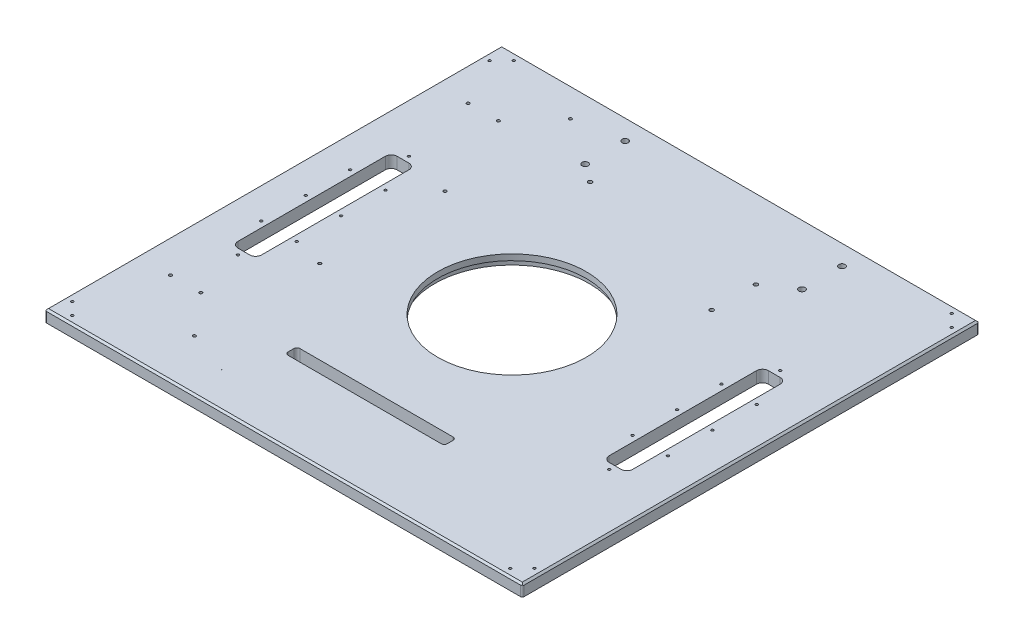
from build123d import *

# Parameters (mm, degrees)
SKETCH1_W                               = 810
SKETCH1_H                               = 775
MAINPLATE_DEPTH                         = 20
SKETCH3_R                               = 126
BUILDPLATEHOLE_DEPTH                    = 561.875431803
SKETCH11_R                              = 131
BUILDCYLINDERFIT_DEPTH                  = 10
SEALCHAMFER_SIZE                        = 3
SKETCH4_W                               = 40
SKETCH4_H                               = 270
CROSSFLOW1_DEPTH                        = 561.875431803
FILLET1_R                               = 10
OVERFLOW_DEPTH                          = 561.875431803
CROSSFLOW2_COUNT                        = 2
CROSSFLOW2_PITCH                        = 630
FILLET1_OF_CROSSFLOW2_R                 = 10
CIRPATTERN1_COUNT                       = 8
TAPPED_HOLE_FOR_M8X1_25_HELICOIL1_D     = 8.3
TAPPED_HOLE_FOR_M8X1_25_HELICOIL1_DEPTH = 14.656428431
TAPPED_HOLE_FOR_M8X1_25_HELICOIL1_TIP   = 2.493571569
M8_TAPPED_HOLE2_D                       = 6.8
M8_TAPPED_HOLE2_DEPTH                   = 18
M8_TAPPED_HOLE2_TIP                     = 2.042926105
M6_TAPPED_HOLE2_D                       = 5
M6_TAPPED_HOLE2_DEPTH                   = 15
M6_TAPPED_HOLE2_TIP                     = 1.502151548
M6_TAPPED_HOLE3_D                       = 5
M6_TAPPED_HOLE3_DEPTH                   = 13.497848452
M6_TAPPED_HOLE3_TIP                     = 1.502151548
TAPPED_HOLE_FOR_M10X1_5_HELICOIL1_D     = 10.5
TAPPED_HOLE_FOR_M10X1_5_HELICOIL1_DEPTH = 18
TAPPED_HOLE_FOR_M10X1_5_HELICOIL1_TIP   = 3.15451825
M8_TAPPED_HOLE4_D                       = 6.8
M8_TAPPED_HOLE4_DEPTH                   = 18
M8_TAPPED_HOLE4_TIP                     = 2.042926105
M5_TAPPED_HOLE1_AT_2_COUNT              = 2
M5_TAPPED_HOLE1_AT_2_PITCH              = 28.991378029
FILLET2_R                               = 3


# Read off the part's stored shape, not the designer's step: CrvPattern2, CrvPattern3, CrvPattern4, CrvPattern5, CrvPattern6
with BuildPart() as part:
    # Sketch1 → MainPlate (new body)
    with BuildSketch(Plane(origin=(0, 0, 0), x_dir=(1, 0, 0), z_dir=(0, 1, 0))):
        Rectangle(SKETCH1_W, SKETCH1_H)
    extrude(amount=MAINPLATE_DEPTH)

    # Sketch3 → BuildPlateHole (cut, through all)
    with BuildSketch(Plane(origin=(0, 20, 0), x_dir=(1, 0, 0), z_dir=(0, 1, 0))):
        with Locations(Location((0, 0, 0), (0, 0, 270))):
            Circle(SKETCH3_R)
    extrude(amount=-BUILDPLATEHOLE_DEPTH, mode=Mode.SUBTRACT)

    # Sketch11 → BuildCylinderFit (cut)
    with BuildSketch(Plane(origin=(0, 0, 0), x_dir=(-1, 0, 0), z_dir=(0, -1, 0))):
        with Locations(Location((0, 0, 0), (0, 0, 90))):
            Circle(SKETCH11_R)
    extrude(amount=-BUILDCYLINDERFIT_DEPTH, mode=Mode.SUBTRACT)

    # SealChamfer
    sealchamfer_edges = [part.edges().sort_by_distance(p)[0] for p in [
        (-405, 20, 0),
        (0, 20, 387.5),
        (405, 20, 0),
        (0, 20, -387.5),
    ]]
    chamfer(sealchamfer_edges, length=SEALCHAMFER_SIZE)

    # Sketch4 → CrossFlow1 (cut, through all)
    with BuildSketch(Plane.XZ):
        with Locations((310, 0)):
            Rectangle(SKETCH4_W, SKETCH4_H)
    crossflow1 = extrude(amount=-CROSSFLOW1_DEPTH, mode=Mode.SUBTRACT)

    # Fillet1
    fillet1_edges = [part.edges().sort_by_distance(p)[0] for p in [
        (330, 10, 135),
        (330, 10, -135),
        (290, 10, -135),
        (290, 10, 135),
    ]]
    fillet(fillet1_edges, radius=FILLET1_R)

    # Sketch10 → Overflow (cut, through all)
    with BuildSketch(Plane(origin=(0, 20, 0), x_dir=(1, 0, 0), z_dir=(0, 1, 0))):
        with BuildLine():
            Line((-130, -230), (130, -230))
            ThreePointArc((130, -230), (133.535533906, -231.464466094), (135, -235))
            Line((135, -235), (135, -245))
            ThreePointArc((135, -245), (133.535533906, -248.535533906), (130, -250))
            Line((130, -250), (-130, -250))
            ThreePointArc((-130, -250), (-133.535533906, -248.535533906), (-135, -245))
            Line((-135, -245), (-135, -235))
            ThreePointArc((-135, -235), (-133.535533906, -231.464466094), (-130, -230))
        make_face()
    extrude(amount=-OVERFLOW_DEPTH, mode=Mode.SUBTRACT)

    # CrossFlow2: CrossFlow1 ×2
    with Locations(*[(-i * CROSSFLOW2_PITCH, 0, 0) for i in range(1, CROSSFLOW2_COUNT)]):
        add(crossflow1, mode=Mode.SUBTRACT)

    # Fillet1 of CrossFlow2
    fillet1_of_crossflow2_edges = [part.edges().sort_by_distance(p)[0] for p in [
        (-300, 10, 135),
        (-300, 10, -135),
        (-340, 10, -135),
        (-340, 10, 135),
    ]]
    fillet(fillet1_of_crossflow2_edges, radius=FILLET1_OF_CROSSFLOW2_R)

    # Sketch17 → Tapped Hole for M6x1.0 Helicoil1 (revolve, cut)
    with BuildSketch(Plane(origin=(0, 0, 204.5), x_dir=(0, 0, -1), z_dir=(1, 0, 0))):
        Polygon((0, 0), (0, 18.127689434), (3.125, 16.25), (3.125, 0), align=None)
    tapped_hole_for_m6x1_0_helicoil1 = revolve(axis=Axis((0, -6.35, 204.5), (0, 1, 0)), mode=Mode.SUBTRACT)

    # CirPattern1: Tapped Hole for M6x1.0 Helicoil1 ×8 about axis
    cirpattern1_axis = Axis((0, 0, 0), (0, 1, 0))
    for i in range(1, CIRPATTERN1_COUNT):
        add(tapped_hole_for_m6x1_0_helicoil1.rotate(cirpattern1_axis, i * 360 / CIRPATTERN1_COUNT), mode=Mode.SUBTRACT)

    # Tapped Hole for M8x1.25 Helicoil1
    with Locations(Plane(origin=(0, 0, 0), x_dir=(-1, 0, 0), z_dir=(0, -1, 0))):
        with Locations((74.25, -128.604772462), (-74.25, -128.604772462), (-148.5, 0), (-74.25, 128.604772462), (74.25, 128.604772462), (148.5, 0)):
            Hole(TAPPED_HOLE_FOR_M8X1_25_HELICOIL1_D / 2, depth=TAPPED_HOLE_FOR_M8X1_25_HELICOIL1_DEPTH)
            with Locations((0, 0, -(TAPPED_HOLE_FOR_M8X1_25_HELICOIL1_DEPTH + TAPPED_HOLE_FOR_M8X1_25_HELICOIL1_TIP / 2))):  # 118° drill point
                Cone(0, TAPPED_HOLE_FOR_M8X1_25_HELICOIL1_D / 2, TAPPED_HOLE_FOR_M8X1_25_HELICOIL1_TIP, mode=Mode.SUBTRACT)

    # M8 Tapped Hole2
    with Locations(Plane(origin=(0, 0, 0), x_dir=(-1, 0, 0), z_dir=(0, -1, 0))):
        with Locations((345, -172.5), (345, 172.5), (165, -327.5), (-165, -327.5), (-165, 327.5), (165, 327.5), (-345, -202.5), (-345, 202.5)):
            Hole(M8_TAPPED_HOLE2_D / 2, depth=M8_TAPPED_HOLE2_DEPTH)
            with Locations((0, 0, -(M8_TAPPED_HOLE2_DEPTH + M8_TAPPED_HOLE2_TIP / 2))):  # 118° drill point
                Cone(0, M8_TAPPED_HOLE2_D / 2, M8_TAPPED_HOLE2_TIP, mode=Mode.SUBTRACT)

    # Sketch27 → M5 Tapped Hole6 (revolve, cut)
    with BuildSketch(Plane(origin=(-283, 0, 0), x_dir=(0, 0, -1), z_dir=(1, 0, 0))):
        Polygon((0, 0), (0, 13.6618073), (2.1, 12.4), (2.1, 0), align=None)
    revolve(axis=Axis((-283, -6.35, 0), (0, 1, 0)), mode=Mode.SUBTRACT)

    # CrvPattern2 outline → CrvPattern2 (revolve, cut)
    with BuildSketch(Plane(origin=(-283, 0, 75.353918671), x_dir=(1, 0, 0), z_dir=(0, 0, 1))):
        Polygon((2.1, 12.4), (0, 13.6618073), (0, 0), (2.1, 0), align=None)
    revolve(axis=Axis((-283, 0, 75.353918671), (0, 1, 0)), mode=Mode.SUBTRACT)

    # CrvPattern2 2 outline → CrvPattern2 2 (revolve, cut)
    with BuildSketch(Plane(origin=(-320, 0, 152), x_dir=(1, 0, 0), z_dir=(0, 0, 1))):
        Polygon((2.1, 12.4), (0, 13.6618073), (0, 0), (2.1, 0), align=None)
    revolve(axis=Axis((-320, 0, 152), (0, 1, 0)), mode=Mode.SUBTRACT)

    # CrvPattern2 3 outline → CrvPattern2 3 (revolve, cut)
    with BuildSketch(Plane(origin=(-357, 0, 75.353918671), x_dir=(1, 0, 0), z_dir=(0, 0, 1))):
        Polygon((2.1, 12.4), (0, 13.6618073), (0, 0), (2.1, 0), align=None)
    revolve(axis=Axis((-357, 0, 75.353918671), (0, 1, 0)), mode=Mode.SUBTRACT)

    # CrvPattern2 4 outline → CrvPattern2 4 (revolve, cut)
    with BuildSketch(Plane(origin=(-357, 0, 0), x_dir=(1, 0, 0), z_dir=(0, 0, 1))):
        Polygon((2.1, 12.4), (0, 13.6618073), (0, 0), (2.1, 0), align=None)
    revolve(axis=Axis((-357, 0, 0), (0, 1, 0)), mode=Mode.SUBTRACT)

    # CrvPattern2 5 outline → CrvPattern2 5 (revolve, cut)
    with BuildSketch(Plane(origin=(-357, 0, -75.353918671), x_dir=(1, 0, 0), z_dir=(0, 0, 1))):
        Polygon((2.1, 12.4), (0, 13.6618073), (0, 0), (2.1, 0), align=None)
    revolve(axis=Axis((-357, 0, -75.353918671), (0, 1, 0)), mode=Mode.SUBTRACT)

    # CrvPattern2 6 outline → CrvPattern2 6 (revolve, cut)
    with BuildSketch(Plane(origin=(-320, 0, -152), x_dir=(1, 0, 0), z_dir=(0, 0, 1))):
        Polygon((2.1, 12.4), (0, 13.6618073), (0, 0), (2.1, 0), align=None)
    revolve(axis=Axis((-320, 0, -152), (0, 1, 0)), mode=Mode.SUBTRACT)

    # CrvPattern2 7 outline → CrvPattern2 7 (revolve, cut)
    with BuildSketch(Plane(origin=(-283, 0, -75.353918671), x_dir=(1, 0, 0), z_dir=(0, 0, 1))):
        Polygon((2.1, 12.4), (0, 13.6618073), (0, 0), (2.1, 0), align=None)
    revolve(axis=Axis((-283, 0, -75.353918671), (0, 1, 0)), mode=Mode.SUBTRACT)

    # Sketch31 → M5 Tapped Hole5 (revolve, cut)
    with BuildSketch(Plane(origin=(273, 0, 0), x_dir=(0, 0, -1), z_dir=(1, 0, 0))):
        Polygon((0, 0), (0, 13.6618073), (2.1, 12.4), (2.1, 0), align=None)
    revolve(axis=Axis((273, -6.35, 0), (0, 1, 0)), mode=Mode.SUBTRACT)

    # CrvPattern3 outline → CrvPattern3 (revolve, cut)
    with BuildSketch(Plane(origin=(273, 0, -75.353918671), x_dir=(1, 0, 0), z_dir=(0, 0, 1))):
        Polygon((2.1, 12.4), (0, 13.6618073), (0, 0), (2.1, 0), align=None)
    revolve(axis=Axis((273, 0, -75.353918671), (0, 1, 0)), mode=Mode.SUBTRACT)

    # CrvPattern3 2 outline → CrvPattern3 2 (revolve, cut)
    with BuildSketch(Plane(origin=(310, 0, -152), x_dir=(1, 0, 0), z_dir=(0, 0, 1))):
        Polygon((2.1, 12.4), (0, 13.6618073), (0, 0), (2.1, 0), align=None)
    revolve(axis=Axis((310, 0, -152), (0, 1, 0)), mode=Mode.SUBTRACT)

    # CrvPattern3 3 outline → CrvPattern3 3 (revolve, cut)
    with BuildSketch(Plane(origin=(347, 0, -75.353918671), x_dir=(1, 0, 0), z_dir=(0, 0, 1))):
        Polygon((2.1, 12.4), (0, 13.6618073), (0, 0), (2.1, 0), align=None)
    revolve(axis=Axis((347, 0, -75.353918671), (0, 1, 0)), mode=Mode.SUBTRACT)

    # CrvPattern3 4 outline → CrvPattern3 4 (revolve, cut)
    with BuildSketch(Plane(origin=(347, 0, 0), x_dir=(1, 0, 0), z_dir=(0, 0, 1))):
        Polygon((2.1, 12.4), (0, 13.6618073), (0, 0), (2.1, 0), align=None)
    revolve(axis=Axis((347, 0, 0), (0, 1, 0)), mode=Mode.SUBTRACT)

    # CrvPattern3 5 outline → CrvPattern3 5 (revolve, cut)
    with BuildSketch(Plane(origin=(347, 0, 75.353918671), x_dir=(1, 0, 0), z_dir=(0, 0, 1))):
        Polygon((2.1, 12.4), (0, 13.6618073), (0, 0), (2.1, 0), align=None)
    revolve(axis=Axis((347, 0, 75.353918671), (0, 1, 0)), mode=Mode.SUBTRACT)

    # CrvPattern3 6 outline → CrvPattern3 6 (revolve, cut)
    with BuildSketch(Plane(origin=(310, 0, 152), x_dir=(1, 0, 0), z_dir=(0, 0, 1))):
        Polygon((2.1, 12.4), (0, 13.6618073), (0, 0), (2.1, 0), align=None)
    revolve(axis=Axis((310, 0, 152), (0, 1, 0)), mode=Mode.SUBTRACT)

    # CrvPattern3 7 outline → CrvPattern3 7 (revolve, cut)
    with BuildSketch(Plane(origin=(273, 0, 75.353918671), x_dir=(1, 0, 0), z_dir=(0, 0, 1))):
        Polygon((2.1, 12.4), (0, 13.6618073), (0, 0), (2.1, 0), align=None)
    revolve(axis=Axis((273, 0, 75.353918671), (0, 1, 0)), mode=Mode.SUBTRACT)

    # Sketch33 → M5 Tapped Hole4 (revolve, cut)
    with BuildSketch(Plane(origin=(280, 20, 0), x_dir=(0, 0, 1), z_dir=(1, 0, 0))):
        Polygon((0, 0), (0, 13.6618073), (2.1, 12.4), (2.1, 0), align=None)
    revolve(axis=Axis((280, 26.35, 0), (0, -1, 0)), mode=Mode.SUBTRACT)

    # CrvPattern4 outline → CrvPattern4 (revolve, cut)
    with BuildSketch(Plane(origin=(280, 0, -75.353918671), x_dir=(1, 0, 0), z_dir=(0, 0, 1))):
        Polygon((0, 20), (0, 6.3381927), (2.1, 7.6), (2.1, 20), align=None)
    revolve(axis=Axis((280, 0, -75.353918671), (0, 1, 0)), mode=Mode.SUBTRACT)

    # CrvPattern4 2 outline → CrvPattern4 2 (revolve, cut)
    with BuildSketch(Plane(origin=(310, 0, -145), x_dir=(1, 0, 0), z_dir=(0, 0, 1))):
        Polygon((0, 20), (0, 6.3381927), (2.1, 7.6), (2.1, 20), align=None)
    revolve(axis=Axis((310, 0, -145), (0, 1, 0)), mode=Mode.SUBTRACT)

    # CrvPattern4 3 outline → CrvPattern4 3 (revolve, cut)
    with BuildSketch(Plane(origin=(340, 0, -75.353918671), x_dir=(1, 0, 0), z_dir=(0, 0, 1))):
        Polygon((0, 20), (0, 6.3381927), (2.1, 7.6), (2.1, 20), align=None)
    revolve(axis=Axis((340, 0, -75.353918671), (0, 1, 0)), mode=Mode.SUBTRACT)

    # CrvPattern4 4 outline → CrvPattern4 4 (revolve, cut)
    with BuildSketch(Plane(origin=(340, 0, 0), x_dir=(1, 0, 0), z_dir=(0, 0, 1))):
        Polygon((0, 20), (0, 6.3381927), (2.1, 7.6), (2.1, 20), align=None)
    revolve(axis=Axis((340, 0, 0), (0, 1, 0)), mode=Mode.SUBTRACT)

    # CrvPattern4 5 outline → CrvPattern4 5 (revolve, cut)
    with BuildSketch(Plane(origin=(340, 0, 75.353918671), x_dir=(1, 0, 0), z_dir=(0, 0, 1))):
        Polygon((0, 20), (0, 6.3381927), (2.1, 7.6), (2.1, 20), align=None)
    revolve(axis=Axis((340, 0, 75.353918671), (0, 1, 0)), mode=Mode.SUBTRACT)

    # CrvPattern4 6 outline → CrvPattern4 6 (revolve, cut)
    with BuildSketch(Plane(origin=(310, 0, 145), x_dir=(1, 0, 0), z_dir=(0, 0, 1))):
        Polygon((0, 20), (0, 6.3381927), (2.1, 7.6), (2.1, 20), align=None)
    revolve(axis=Axis((310, 0, 145), (0, 1, 0)), mode=Mode.SUBTRACT)

    # CrvPattern4 7 outline → CrvPattern4 7 (revolve, cut)
    with BuildSketch(Plane(origin=(280, 0, 75.353918671), x_dir=(1, 0, 0), z_dir=(0, 0, 1))):
        Polygon((0, 20), (0, 6.3381927), (2.1, 7.6), (2.1, 20), align=None)
    revolve(axis=Axis((280, 0, 75.353918671), (0, 1, 0)), mode=Mode.SUBTRACT)

    # Sketch35 → M5 Tapped Hole3 (revolve, cut)
    with BuildSketch(Plane(origin=(-350, 20, 0), x_dir=(0, 0, 1), z_dir=(1, 0, 0))):
        Polygon((0, 0), (0, 13.6618073), (2.1, 12.4), (2.1, 0), align=None)
    revolve(axis=Axis((-350, 26.35, 0), (0, -1, 0)), mode=Mode.SUBTRACT)

    # CrvPattern5 outline → CrvPattern5 (revolve, cut)
    with BuildSketch(Plane(origin=(-350, 0, -75.353918671), x_dir=(1, 0, 0), z_dir=(0, 0, 1))):
        Polygon((0, 20), (0, 6.3381927), (2.1, 7.6), (2.1, 20), align=None)
    revolve(axis=Axis((-350, 0, -75.353918671), (0, 1, 0)), mode=Mode.SUBTRACT)

    # CrvPattern5 2 outline → CrvPattern5 2 (revolve, cut)
    with BuildSketch(Plane(origin=(-320, 0, -145), x_dir=(1, 0, 0), z_dir=(0, 0, 1))):
        Polygon((0, 20), (0, 6.3381927), (2.1, 7.6), (2.1, 20), align=None)
    revolve(axis=Axis((-320, 0, -145), (0, 1, 0)), mode=Mode.SUBTRACT)

    # CrvPattern5 3 outline → CrvPattern5 3 (revolve, cut)
    with BuildSketch(Plane(origin=(-290, 0, -75.353918671), x_dir=(1, 0, 0), z_dir=(0, 0, 1))):
        Polygon((0, 20), (0, 6.3381927), (2.1, 7.6), (2.1, 20), align=None)
    revolve(axis=Axis((-290, 0, -75.353918671), (0, 1, 0)), mode=Mode.SUBTRACT)

    # CrvPattern5 4 outline → CrvPattern5 4 (revolve, cut)
    with BuildSketch(Plane(origin=(-290, 0, 0), x_dir=(1, 0, 0), z_dir=(0, 0, 1))):
        Polygon((0, 20), (0, 6.3381927), (2.1, 7.6), (2.1, 20), align=None)
    revolve(axis=Axis((-290, 0, 0), (0, 1, 0)), mode=Mode.SUBTRACT)

    # CrvPattern5 5 outline → CrvPattern5 5 (revolve, cut)
    with BuildSketch(Plane(origin=(-290, 0, 75.353918671), x_dir=(1, 0, 0), z_dir=(0, 0, 1))):
        Polygon((0, 20), (0, 6.3381927), (2.1, 7.6), (2.1, 20), align=None)
    revolve(axis=Axis((-290, 0, 75.353918671), (0, 1, 0)), mode=Mode.SUBTRACT)

    # CrvPattern5 6 outline → CrvPattern5 6 (revolve, cut)
    with BuildSketch(Plane(origin=(-320, 0, 145), x_dir=(1, 0, 0), z_dir=(0, 0, 1))):
        Polygon((0, 20), (0, 6.3381927), (2.1, 7.6), (2.1, 20), align=None)
    revolve(axis=Axis((-320, 0, 145), (0, 1, 0)), mode=Mode.SUBTRACT)

    # CrvPattern5 7 outline → CrvPattern5 7 (revolve, cut)
    with BuildSketch(Plane(origin=(-350, 0, 75.353918671), x_dir=(1, 0, 0), z_dir=(0, 0, 1))):
        Polygon((0, 20), (0, 6.3381927), (2.1, 7.6), (2.1, 20), align=None)
    revolve(axis=Axis((-350, 0, 75.353918671), (0, 1, 0)), mode=Mode.SUBTRACT)

    # M6 Tapped Hole2
    with Locations(Plane(origin=(0, 20, 0), x_dir=(1, 0, 0), z_dir=(0, 1, 0))):
        with Locations((-296.207106781, 273.080412807), (-347.5, 273.080412807), (-296.207106781, -231.919587193), (-347.5, -231.919587193)):
            Hole(M6_TAPPED_HOLE2_D / 2, depth=M6_TAPPED_HOLE2_DEPTH)
            with Locations((0, 0, -(M6_TAPPED_HOLE2_DEPTH + M6_TAPPED_HOLE2_TIP / 2))):  # 118° drill point
                Cone(0, M6_TAPPED_HOLE2_D / 2, M6_TAPPED_HOLE2_TIP, mode=Mode.SUBTRACT)

    # M6 Tapped Hole3
    with Locations(Plane(origin=(0, 20, 0), x_dir=(1, 0, 0), z_dir=(0, 1, 0))):
        with Locations((-238, -300.919587193), (-238, -88.252920526), (-238, 124.41374614), (-238, 337.080412807)):
            Hole(M6_TAPPED_HOLE3_D / 2, depth=M6_TAPPED_HOLE3_DEPTH)
            with Locations((0, 0, -(M6_TAPPED_HOLE3_DEPTH + M6_TAPPED_HOLE3_TIP / 2))):  # 118° drill point
                Cone(0, M6_TAPPED_HOLE3_D / 2, M6_TAPPED_HOLE3_TIP, mode=Mode.SUBTRACT)

    # Tapped Hole for M10x1.5 Helicoil1
    with Locations(Plane(origin=(0, 20, 0), x_dir=(1, 0, 0), z_dir=(0, 1, 0))):
        with Locations((209.0925, 283.000832071), (209.0925, 350.895382341), (-158.9075, 283.000832071), (-158.9075, 350.895382341)):
            Hole(TAPPED_HOLE_FOR_M10X1_5_HELICOIL1_D / 2, depth=TAPPED_HOLE_FOR_M10X1_5_HELICOIL1_DEPTH)
            with Locations((0, 0, -(TAPPED_HOLE_FOR_M10X1_5_HELICOIL1_DEPTH + TAPPED_HOLE_FOR_M10X1_5_HELICOIL1_TIP / 2))):  # 118° drill point
                Cone(0, TAPPED_HOLE_FOR_M10X1_5_HELICOIL1_D / 2, TAPPED_HOLE_FOR_M10X1_5_HELICOIL1_TIP, mode=Mode.SUBTRACT)

    # M8 Tapped Hole4
    with Locations(Plane(origin=(0, 20, 0), x_dir=(1, 0, 0), z_dir=(0, 1, 0))):
        with Locations((162.9, 251.000832071), (162.9, 176.000832071), (-128.5, 261.000832071)):
            Hole(M8_TAPPED_HOLE4_D / 2, depth=M8_TAPPED_HOLE4_DEPTH)
            with Locations((0, 0, -(M8_TAPPED_HOLE4_DEPTH + M8_TAPPED_HOLE4_TIP / 2))):  # 118° drill point
                Cone(0, M8_TAPPED_HOLE4_D / 2, M8_TAPPED_HOLE4_TIP, mode=Mode.SUBTRACT)

    # Sketch45 → M5 Tapped Hole1 (revolve, cut)
    with BuildSketch(Plane(origin=(371.5, 20, 374.5), x_dir=(0, 0, 1), z_dir=(1, 0, 0))):
        Polygon((0, 0), (0, 13.6618073), (2.1, 12.4), (2.1, 0), align=None)
    m5_tapped_hole1 = revolve(axis=Axis((371.5, 26.35, 374.5), (0, -1, 0)), mode=Mode.SUBTRACT)

    # M5 Tapped Hole1 at 2: M5 Tapped Hole1 ×2
    with Locations(*[Vector(0.7071067811865476, 0, -0.7071067811865476) * (i * M5_TAPPED_HOLE1_AT_2_PITCH) for i in range(1, M5_TAPPED_HOLE1_AT_2_COUNT)]):
        add(m5_tapped_hole1, mode=Mode.SUBTRACT)

    # Mirror3: M5 Tapped Hole1 across plane
    add(m5_tapped_hole1.mirror(Plane(origin=(0, 0, 0), x_dir=(0, 0, 1), z_dir=(1, 0, 0))), mode=Mode.SUBTRACT)

    # Mirror3 copy 1 sketch → Mirror3 copy 1 (revolve, cut)
    with BuildSketch(Plane(origin=(-392, 20, 354), x_dir=(0, 0, 1), z_dir=(-1, 0, 0))):
        Polygon((0, 0), (0, -13.6618073), (2.1, -12.4), (2.1, 0), align=None)
    revolve(axis=Axis((-392, 26.35, 354), (0, 1, 0)), mode=Mode.SUBTRACT)

    # Mirror4: M5 Tapped Hole1 across plane
    add(m5_tapped_hole1.mirror(Plane.XY), mode=Mode.SUBTRACT)

    # Mirror4 copy 1 sketch → Mirror4 copy 1 (revolve, cut)
    with BuildSketch(Plane(origin=(392, 20, -354), x_dir=(0, 0, -1), z_dir=(1, 0, 0))):
        Polygon((0, 0), (0, -13.6618073), (2.1, -12.4), (2.1, 0), align=None)
    revolve(axis=Axis((392, 26.35, -354), (0, 1, 0)), mode=Mode.SUBTRACT)

    # Mirror4 copy 2 sketch → Mirror4 copy 2 (revolve, cut)
    with BuildSketch(Plane(origin=(-371.5, 20, -374.5), x_dir=(0, 0, -1), z_dir=(-1, 0, 0))):
        Polygon((0, 0), (0, 13.6618073), (2.1, 12.4), (2.1, 0), align=None)
    revolve(axis=Axis((-371.5, 26.35, -374.5), (0, -1, 0)), mode=Mode.SUBTRACT)

    # Mirror4 copy 3 sketch → Mirror4 copy 3 (revolve, cut)
    with BuildSketch(Plane(origin=(-392, 20, -354), x_dir=(0, 0, -1), z_dir=(-1, 0, 0))):
        Polygon((0, 0), (0, 13.6618073), (2.1, 12.4), (2.1, 0), align=None)
    revolve(axis=Axis((-392, 26.35, -354), (0, -1, 0)), mode=Mode.SUBTRACT)

    # Sketch47 → M5 Tapped Hole2 (revolve, cut)
    with BuildSketch(Plane(origin=(0, 0, 223), x_dir=(0, 0, -1), z_dir=(1, 0, 0))):
        Polygon((0, 0), (0, 13.6618073), (2.1, 12.4), (2.1, 0), align=None)
    revolve(axis=Axis((0, -6.35, 223), (0, 1, 0)), mode=Mode.SUBTRACT)

    # CrvPattern6 outline → CrvPattern6 (revolve, cut)
    with BuildSketch(Plane(origin=(-71.428355745, 0, 223), x_dir=(1, 0, 0), z_dir=(0, 0, 1))):
        Polygon((2.1, 12.4), (0, 13.6618073), (0, 0), (2.1, 0), align=None)
    revolve(axis=Axis((-71.428355745, 0, 223), (0, 1, 0)), mode=Mode.SUBTRACT)

    # CrvPattern6 2 outline → CrvPattern6 2 (revolve, cut)
    with BuildSketch(Plane(origin=(-142, 0, 240.000000006), x_dir=(1, 0, 0), z_dir=(0, 0, 1))):
        Polygon((2.1, 12.4), (0, 13.6618073), (0, 0), (2.1, 0), align=None)
    revolve(axis=Axis((-142, 0, 240.000000006), (0, 1, 0)), mode=Mode.SUBTRACT)

    # CrvPattern6 3 outline → CrvPattern6 3 (revolve, cut)
    with BuildSketch(Plane(origin=(-71.428355734, 0, 257), x_dir=(1, 0, 0), z_dir=(0, 0, 1))):
        Polygon((2.1, 12.4), (0, 13.6618073), (0, 0), (2.1, 0), align=None)
    revolve(axis=Axis((-71.428355734, 0, 257), (0, 1, 0)), mode=Mode.SUBTRACT)

    # CrvPattern6 4 outline → CrvPattern6 4 (revolve, cut)
    with BuildSketch(Plane(origin=(6e-09, 0, 257), x_dir=(1, 0, 0), z_dir=(0, 0, 1))):
        Polygon((2.1, 12.4), (0, 13.6618073), (0, 0), (2.1, 0), align=None)
    revolve(axis=Axis((6e-09, 0, 257), (0, 1, 0)), mode=Mode.SUBTRACT)

    # CrvPattern6 5 outline → CrvPattern6 5 (revolve, cut)
    with BuildSketch(Plane(origin=(71.428355745, 0, 257), x_dir=(1, 0, 0), z_dir=(0, 0, 1))):
        Polygon((2.1, 12.4), (0, 13.6618073), (0, 0), (2.1, 0), align=None)
    revolve(axis=Axis((71.428355745, 0, 257), (0, 1, 0)), mode=Mode.SUBTRACT)

    # CrvPattern6 6 outline → CrvPattern6 6 (revolve, cut)
    with BuildSketch(Plane(origin=(142, 0, 239.999999994), x_dir=(1, 0, 0), z_dir=(0, 0, 1))):
        Polygon((2.1, 12.4), (0, 13.6618073), (0, 0), (2.1, 0), align=None)
    revolve(axis=Axis((142, 0, 239.999999994), (0, 1, 0)), mode=Mode.SUBTRACT)

    # CrvPattern6 7 outline → CrvPattern6 7 (revolve, cut)
    with BuildSketch(Plane(origin=(71.428355733, 0, 223), x_dir=(1, 0, 0), z_dir=(0, 0, 1))):
        Polygon((2.1, 12.4), (0, 13.6618073), (0, 0), (2.1, 0), align=None)
    revolve(axis=Axis((71.428355733, 0, 223), (0, 1, 0)), mode=Mode.SUBTRACT)

    # Fillet2
    fillet2_edges = [part.edges().sort_by_distance(p)[0] for p in [
        (405, 8.5, -387.5),
        (405, 8.5, 387.5),
        (-405, 8.5, -387.5),
        (-405, 8.5, 387.5),
    ]]
    fillet(fillet2_edges, radius=FILLET2_R)


solid = part.part
